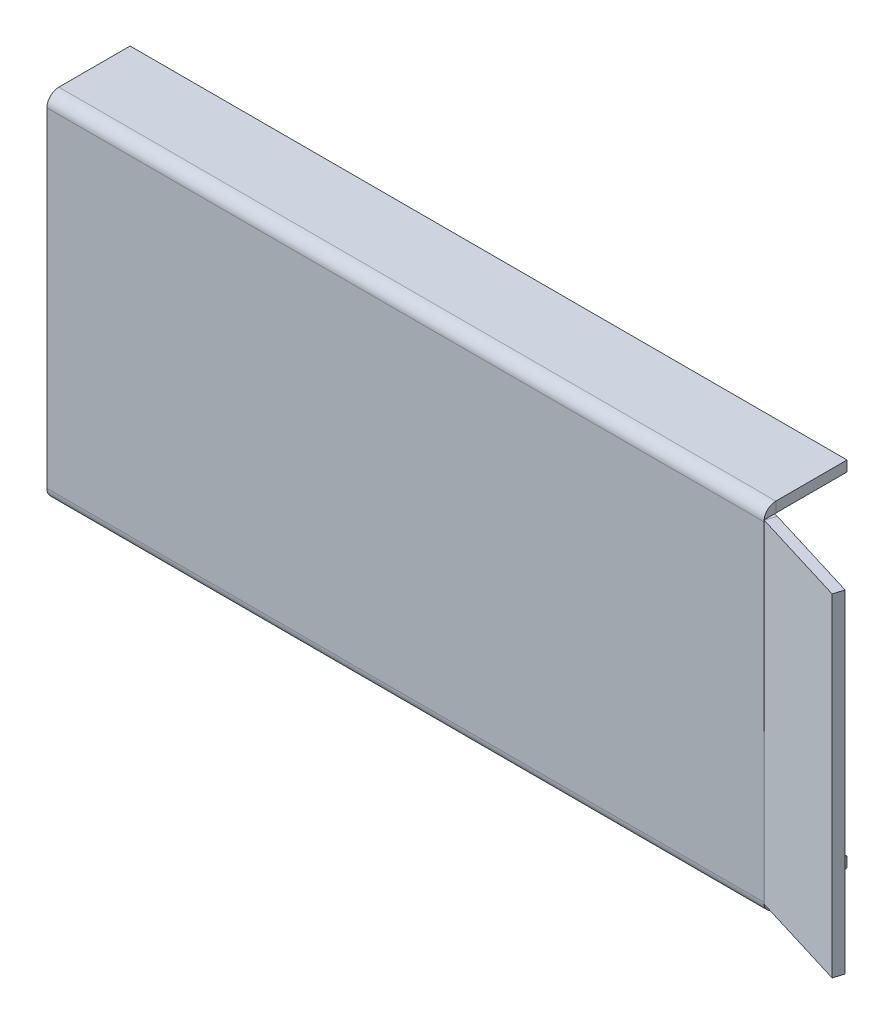
from build123d import *

# Parameters (mm, degrees)
SKETCH1_W                      = 345
SKETCH1_H                      = 160
BASE_FLANGE1_DEPTH             = 5
EDGE_FLANGE1_STRIP_CUT_DEPTH   = 160
EDGE_FLANGE1_DEPTH             = 160
EDGE_FLANGE2_STRIP_W           = 21.4732
EDGE_FLANGE2_STRIP_H           = 5
EDGE_FLANGE2_STRIP_CUT_DEPTH   = 344.889914392
EDGE_FLANGE2_STRIP_2_W         = 21.4732
EDGE_FLANGE2_STRIP_2_H         = 5
EDGE_FLANGE2_STRIP_CUT_2_DEPTH = 344.889914392
EDGE_FLANGE2_DEPTH             = 344.889914392
EDGE_FLANGE2_BEND_DEPTH        = 344.889914392


# Sheet-metal steps are written as plain solids
with BuildPart() as part:
    # Sketch1 → Base-Flange1 (new body)
    with BuildSketch(Plane.XY):
        with Locations((172.5, -80)):
            Rectangle(SKETCH1_W, SKETCH1_H)
    extrude(amount=-BASE_FLANGE1_DEPTH)

    # Edge-Flange1 strip (across the edge) → Edge-Flange1 strip cut (cut)
    with BuildSketch(Plane(origin=(345, -160, 0), x_dir=(-0.29237170472273066, 0, 0.9563047559630373), z_dir=(0, 1, 0))):
        Polygon((-11.027493953, 18.967789372), (-4.749337863, -1.567133914), (0.032185917, -0.10527539), (-6.245970173, 20.429647896), align=None)
    extrude(amount=EDGE_FLANGE1_STRIP_CUT_DEPTH, mode=Mode.SUBTRACT)

    # Edge-Flange1 section (across the edge) → Edge-Flange1 (add)
    with BuildSketch(Plane(origin=(345, -160, 0), x_dir=(-0.29237170472273066, 0, 0.9563047559630373), z_dir=(0, 1, 0))):
        with BuildLine():
            Line((-5, 0.110085608), (-5, 49.252744993))
            Line((-5, 49.252744993), (0, 49.252744993))
            Line((0, 49.252744993), (0, 0.110085608))
            ThreePointArc((0, 0.110085608), (0.008090915, 0.001209195), (0.032185917, -0.10527539))
            Line((0.032185917, -0.10527539), (-4.749337863, -1.567133914))
            ThreePointArc((-4.749337863, -1.567133914), (-4.936988402, -0.73783786), (-5, 0.110085608))
        make_face()
    extrude(amount=EDGE_FLANGE1_DEPTH)

    # Edge-Flange2 strip (across the edge) → Edge-Flange2 strip cut (cut)
    with BuildSketch(Plane(origin=(344.889914392, -160, -5), x_dir=(0, 1, 0), z_dir=(-1, 0, 0))):
        with Locations((-10, -2.5)):
            Rectangle(EDGE_FLANGE2_STRIP_W, EDGE_FLANGE2_STRIP_H)
    extrude(amount=EDGE_FLANGE2_STRIP_CUT_DEPTH, mode=Mode.SUBTRACT)

    # Edge-Flange2 strip 2 (across the edge) → Edge-Flange2 strip cut 2 (cut)
    with BuildSketch(Plane(origin=(0, 0, -5), x_dir=(0, -1, 0), z_dir=(1, 0, 0))):
        with Locations((-10, -2.5)):
            Rectangle(EDGE_FLANGE2_STRIP_2_W, EDGE_FLANGE2_STRIP_2_H)
    extrude(amount=EDGE_FLANGE2_STRIP_CUT_2_DEPTH, mode=Mode.SUBTRACT)

    # Edge-Flange2 section (across the edge) → Edge-Flange2 (add)
    with BuildSketch(Plane(origin=(344.889914392, -160, -5), x_dir=(0, 1, 0), z_dir=(-1, 0, 0))):
        with BuildLine():
            Line((-5, 0.7366), (-5, 35))
            Line((-5, 35), (0, 35))
            Line((0, 35), (0, 0.7366))
            ThreePointArc((0, 0.7366), (0.215745145, 0.215745145), (0.7366, 0))
            Line((0.7366, 0), (0.7366, -5))
            ThreePointArc((0.7366, -5), (-3.319788761, -3.319788761), (-5, 0.7366))
        make_face()
    extrude(amount=EDGE_FLANGE2_DEPTH)

    # Edge-Flange2 section 2 (across the edge) → Edge-Flange2 bend (add)
    with BuildSketch(Plane(origin=(0, 0, -5), x_dir=(0, -1, 0), z_dir=(1, 0, 0))):
        with BuildLine():
            Line((-5, 0.7366), (-5, 35))
            Line((-5, 35), (0, 35))
            Line((0, 35), (0, 0.7366))
            ThreePointArc((0, 0.7366), (0.215745145, 0.215745145), (0.7366, 0))
            Line((0.7366, 0), (0.7366, -5))
            ThreePointArc((0.7366, -5), (-3.319788761, -3.319788761), (-5, 0.7366))
        make_face()
    extrude(amount=EDGE_FLANGE2_BEND_DEPTH)


solid = part.part
